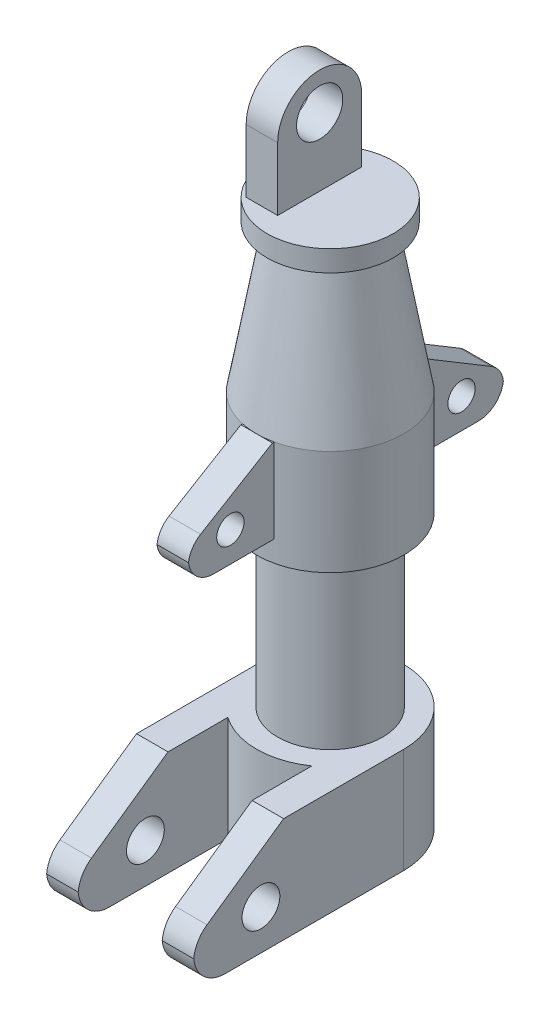
from build123d import *

# Parameters (mm, degrees)
SKETCH1_R           = 35
BOSS_EXTRUDE1_DEPTH = 50
SKETCH6_R           = 25
BOSS_EXTRUDE2_DEPTH = 80
SKETCH7_R           = 35
BOSS_EXTRUDE3_DEPTH = 50
SKETCH10_R          = 30
BOSS_EXTRUDE5_DEPTH = 10
SKETCH12_W          = 70
SKETCH12_H          = 100.009163948
BOSS_EXTRUDE6_DEPTH = 50
CUT_EXTRUDE1_DEPTH  = 288.231322933
CUT_EXTRUDE2_DEPTH  = 281.761166962
FILLET1_R           = 15
SKETCH15_R          = 9
CUT_EXTRUDE3_DEPTH  = 288.208392811
BOSS_EXTRUDE8_DEPTH = 7.5
FILLET2_R           = 12
SKETCH17_R          = 6.5
CUT_EXTRUDE4_DEPTH  = 282.771025659
FILLET3_R           = 12
SKETCH18_W          = 15
SKETCH18_H          = 40
BOSS_EXTRUDE9_DEPTH = 50
CUT_EXTRUDE5_DEPTH  = 331.323570005
SKETCH20_R          = 11
CUT_EXTRUDE6_DEPTH  = 331.323570005


with BuildPart() as part:
    # Sketch1 → Boss-Extrude1 (new body)
    with BuildSketch(Plane(origin=(0, 0, 0), x_dir=(1, 0, 0), z_dir=(0, 1, 0))):
        with Locations(Location((0, 0, 0), (0, 0, 270))):
            Circle(SKETCH1_R)
    extrude(amount=BOSS_EXTRUDE1_DEPTH)

    # Sketch6 → Boss-Extrude2 (add)
    with BuildSketch(Plane(origin=(0, 50, 0), x_dir=(1, 0, 0), z_dir=(0, 1, 0))):
        with Locations(Location((0, 0, 0), (0, 0, 270))):
            Circle(SKETCH6_R)
    extrude(amount=BOSS_EXTRUDE2_DEPTH)

    # Sketch7 → Boss-Extrude3 (add)
    with BuildSketch(Plane(origin=(0, 130, 0), x_dir=(1, 0, 0), z_dir=(0, 1, 0))):
        with Locations(Location((0, 0, 0), (0, 0, 270))):
            Circle(SKETCH7_R)
    extrude(amount=BOSS_EXTRUDE3_DEPTH)



with BuildPart() as body_2:
    # Sketch10 → Boss-Extrude5 (new body)
    with BuildSketch(Plane(origin=(0, 250, 0), x_dir=(1, 0, 0), z_dir=(0, 1, 0))):
        with Locations(Location((0, 0, 0), (0, 0, 270))):
            Circle(SKETCH10_R)
    extrude(amount=BOSS_EXTRUDE5_DEPTH)


with BuildPart() as part_1:
    add(part.part)

    add(body_2.part)  # Revolve1 merges body 2
    # Sketch11 → Revolve1 (revolve)
    with BuildSketch(Plane(origin=(0, 0, 0), x_dir=(0, 0, -1), z_dir=(1, 0, 0))):
        Polygon((0, 250), (22.65711135, 250), (35, 180), (0, 180), align=None)
    revolve(axis=Axis((0, 180, 0), (0, 1, 0)))

    # Sketch12 → Boss-Extrude6 (add)
    with BuildSketch(Plane.XZ):
        with Locations((0, 50.004581974)):
            Rectangle(SKETCH12_W, SKETCH12_H)
    extrude(amount=-BOSS_EXTRUDE6_DEPTH)

    # Sketch13 → Cut-Extrude1 (cut, through all)
    with BuildSketch(Plane.ZY.offset(35)):
        Polygon((57.164723746, 50), (100.009163948, 20), (100.009163948, 50), align=None)
    extrude(amount=-CUT_EXTRUDE1_DEPTH, mode=Mode.SUBTRACT)

    # Sketch14 → Cut-Extrude2 (cut, through all)
    with BuildSketch(Plane.XZ):
        with BuildLine():
            Line((-20, 108.740570097), (20, 108.740570097))
            Line((20, 108.740570097), (20, 28.722813233))
            ThreePointArc((20, 28.722813233), (0, 35), (-20, 28.722813233))
            Line((-20, 28.722813233), (-20, 108.740570097))
        make_face()
    extrude(amount=-CUT_EXTRUDE2_DEPTH, mode=Mode.SUBTRACT)

    # Fillet1
    # the kernel refuses this fillet: 15 mm, written as the material it takes off along each edge
    with BuildSketch(Plane(origin=(-17.5, 0, 100.009163948), x_dir=(0, 0, -1), z_dir=(1, 0, 0)), Plane(origin=(-72.5, 0, 100.009163948), x_dir=(0, 0, -1), z_dir=(1, 0, 0))) as fillet1_piece_1:
        with BuildLine():
            CenterArc((FILLET1_R, FILLET1_R), FILLET1_R, 180, 90)
            Line((0, FILLET1_R), (0, 0))
            Line((0, 0), (FILLET1_R, 0))
        make_face()
    extrude(amount=90, mode=Mode.SUBTRACT)
    with BuildSketch(Plane(origin=(0.478735604, 20, 100.009163948), x_dir=(0, -1, 0), z_dir=(1, 0, 0)), Plane(origin=(-54.521264396, 20, 100.009163948), x_dir=(0, -1, 0), z_dir=(1, 0, 0))) as fillet1_piece_2:
        with BuildLine():
            CenterArc((FILLET1_R * 0.520567050552, FILLET1_R), FILLET1_R, 215, 55)
            Line((-FILLET1_R * 0.298584993737, FILLET1_R * 0.426423563649), (0, 0))
            Line((0, 0), (FILLET1_R * 0.520567050552, 0))
        make_face()
    extrude(amount=54.042528791, mode=Mode.SUBTRACT)

    # Sketch15 → Cut-Extrude3 (cut, through all)
    with BuildSketch(Plane.ZY.offset(35)):
        with Locations((67.943288424, 19)):
            Circle(SKETCH15_R)
    extrude(amount=-CUT_EXTRUDE3_DEPTH, mode=Mode.SUBTRACT)

    # Sketch16 → Boss-Extrude8 (add, symmetric)
    with BuildSketch(Plane(origin=(0, 0, 0), x_dir=(0, 0, -1), z_dir=(1, 0, 0))):
        Polygon((-35, 180), (-75, 155.965575239), (-75, 140), (-35, 140), (0, 140), (0, 180), align=None)
    boss_extrude8 = extrude(amount=BOSS_EXTRUDE8_DEPTH, both=True)

    # Fillet2
    # the kernel refuses this fillet: 12 mm, written as the material it takes off along each edge
    with BuildSketch(Plane(origin=(-37.5, 140, 75), x_dir=(0, 0, -1), z_dir=(1, 0, 0))) as fillet2_piece_1:
        with BuildLine():
            CenterArc((FILLET2_R, FILLET2_R), FILLET2_R, 180, 90)
            Line((0, FILLET2_R), (0, 0))
            Line((0, 0), (FILLET2_R, 0))
        make_face()
    extrude(amount=75, mode=Mode.SUBTRACT)
    with BuildSketch(Plane(origin=(-24.473183346, 155.965575239, 75), x_dir=(0, 0.5150380749100483, -0.8571673007021159), z_dir=(1, 0, 0))) as fillet2_piece_2:
        with BuildLine():
            CenterArc((FILLET2_R * 0.565772778188, -FILLET2_R), FILLET2_R, 90, 59)
            Line((-FILLET2_R * 0.291394522514, -FILLET2_R * 0.48496192509), (0, 0))
            Line((0, 0), (FILLET2_R * 0.565772778188, 0))
        make_face()
    extrude(amount=48.946366691, mode=Mode.SUBTRACT)

    # Sketch17 → Cut-Extrude4 (cut, through all)
    with BuildSketch(Plane(origin=(7.5, 0, 0), x_dir=(0, 0, -1), z_dir=(1, 0, 0))):
        with Locations((-55, 154.29)):
            Circle(SKETCH17_R)
    cut_extrude4 = extrude(amount=-CUT_EXTRUDE4_DEPTH, mode=Mode.SUBTRACT)

    # Mirror1: Boss-Extrude8 across plane
    add(boss_extrude8.mirror(Plane.XY))

    # Fillet3
    # the kernel refuses this fillet: 12 mm, written as the material it takes off along each edge
    with BuildSketch(Plane(origin=(-37.5, 140, -75), x_dir=(0, 0, 1), z_dir=(1, 0, 0))) as fillet3_piece_1:
        with BuildLine():
            CenterArc((FILLET3_R, -FILLET3_R), FILLET3_R, 90, 90)
            Line((0, -FILLET3_R), (0, 0))
            Line((0, 0), (FILLET3_R, 0))
        make_face()
    extrude(amount=75, mode=Mode.SUBTRACT)
    with BuildSketch(Plane(origin=(-24.473183346, 155.965575239, -75), x_dir=(0, 0.5150380749100483, 0.8571673007021159), z_dir=(1, 0, 0))) as fillet3_piece_2:
        with BuildLine():
            CenterArc((FILLET3_R * 0.565772778188, FILLET3_R), FILLET3_R, 211, 59)
            Line((-FILLET3_R * 0.291394522514, FILLET3_R * 0.48496192509), (0, 0))
            Line((0, 0), (FILLET3_R * 0.565772778188, 0))
        make_face()
    extrude(amount=48.946366691, mode=Mode.SUBTRACT)

    # Mirror2: Cut-Extrude4 across plane
    add(cut_extrude4.mirror(Plane.XY), mode=Mode.SUBTRACT)

    # Sketch18 → Boss-Extrude9 (add)
    with BuildSketch(Plane(origin=(0, 260, 0), x_dir=(1, 0, 0), z_dir=(0, 1, 0))):
        with Locations((-12.5, 0)):
            Rectangle(SKETCH18_W, SKETCH18_H)
    extrude(amount=BOSS_EXTRUDE9_DEPTH)

    # Sketch19 → Cut-Extrude5 (cut, through all)
    with BuildSketch(Plane.ZY.offset(20)):
        with BuildLine():
            Line((20, 310), (-1.45e-07, 310))
            ThreePointArc((-1.45e-07, 310), (14.142135572, 304.142135675), (20, 290))
            Line((20, 290), (20, 310))
        make_face()
        with BuildLine():
            Line((-20, 310), (-20, 290))
            ThreePointArc((-20, 290), (-14.142135675, 304.142135572), (-1.45e-07, 310))
            Line((-1.45e-07, 310), (-20, 310))
        make_face()
    extrude(amount=-CUT_EXTRUDE5_DEPTH, mode=Mode.SUBTRACT)

    # Sketch20 → Cut-Extrude6 (cut, through all)
    with BuildSketch(Plane.ZY.offset(20)):
        with Locations((0, 292.448780647)):
            Circle(SKETCH20_R)
    extrude(amount=-CUT_EXTRUDE6_DEPTH, mode=Mode.SUBTRACT)


solid = part_1.part
